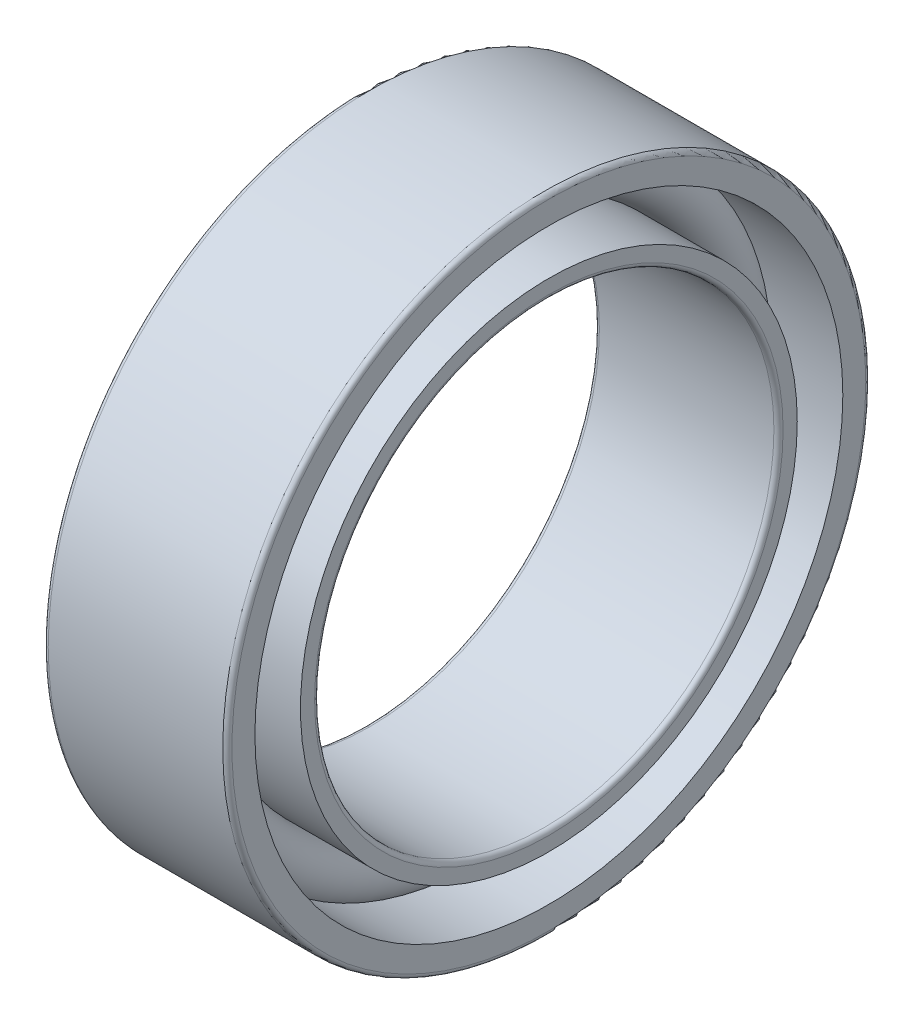
from build123d import *

# Parameters (mm, degrees)
CAGSPISKE_W     = 0.9
CAGSPISKE_H     = 0.6
CAGESPINE_ANGLE = 0.001
BALSIMSKE_R     = 1.8


with BuildPart() as part:
    # CagSpiSke → CageSpine (revolve)
    with BuildSketch(Plane.XY):
        with Locations((0, 18)):
            Rectangle(CAGSPISKE_W, CAGSPISKE_H)
    revolve(axis=Axis((-20.6375, 0, 0), (1, 0, 0)), revolution_arc=CAGESPINE_ANGLE)

    # BalSimSke → BallsSimplified (revolve)
    with BuildSketch(Plane.XY):
        with Locations((0, 18)):
            Circle(BALSIMSKE_R)
    revolve(axis=Axis((-10, 0, 0), (1, 0, 0)))

    # InnRacSke → InnerRace (revolve)
    with BuildSketch(Plane.XY):
        with BuildLine():
            Line((-1.307908636, 16.8), (-6, 16.8))
            Line((-6, 16.8), (-6, 15.3))
            ThreePointArc((-6, 15.3), (-5.912132034, 15.087867966), (-5.7, 15))
            Line((-5.7, 15), (5.7, 15))
            ThreePointArc((5.7, 15), (5.912132034, 15.087867966), (6, 15.3))
            Line((6, 15.3), (6, 16.225))
            Line((6, 16.225), (0, 16.225))
            ThreePointArc((0, 16.225), (-0.714361603, 16.375096157), (-1.307908636, 16.8))
        make_face()
    revolve(axis=Axis((-20.6375, 0, 0), (1, 0, 0)))

    # OutRacSke → OuterRace (revolve)
    with BuildSketch(Plane.XY):
        with BuildLine():
            Line((0, 19.775), (-6, 19.775))
            Line((-6, 19.775), (-6, 20.7))
            ThreePointArc((-6, 20.7), (-5.912132034, 20.912132034), (-5.7, 21))
            Line((-5.7, 21), (5.7, 21))
            ThreePointArc((5.7, 21), (5.912132034, 20.912132034), (6, 20.7))
            Line((6, 20.7), (6, 19.2))
            Line((6, 19.2), (1.307908636, 19.2))
            ThreePointArc((1.307908636, 19.2), (0.714361603, 19.624903843), (0, 19.775))
        make_face()
    revolve(axis=Axis((-20.6375, 0, 0), (1, 0, 0)))


solid = part.part
